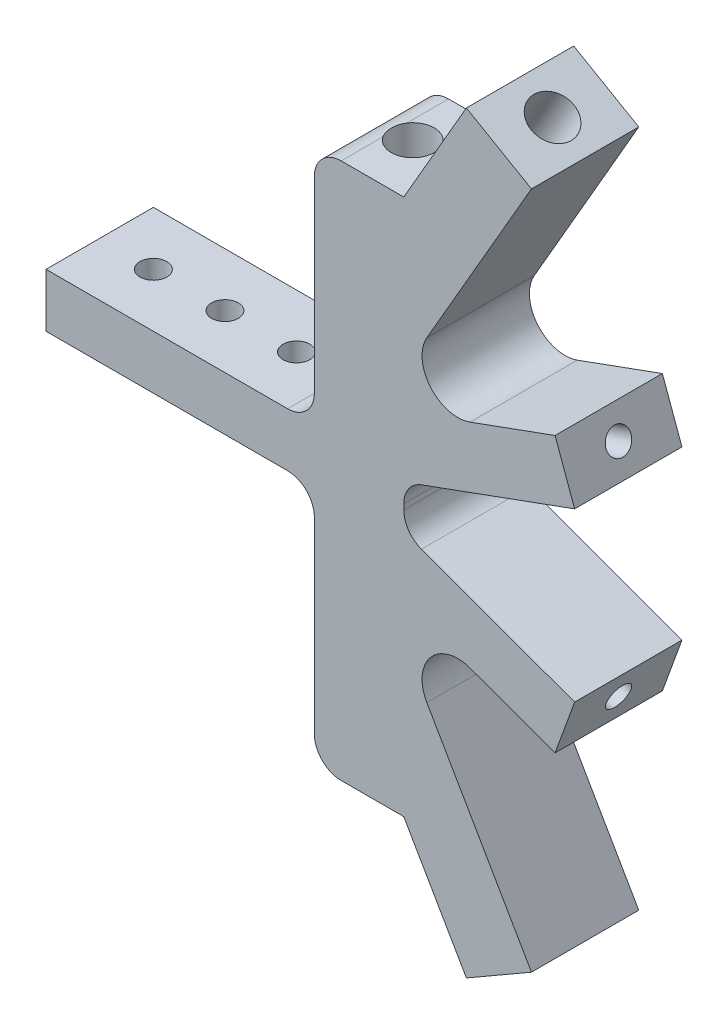
from build123d import *

# Parameters (mm, degrees)
EXTRUDE_1_DEPTH      = 6
FILLET_4_R           = 1.5
FILLET_5_R           = 2
SKETCH_7_R           = 1.2
CUT_EXTRUDE_6_DEPTH  = 10
SKETCH_8_R           = 0.7
CUT_EXTRUDE_7_DEPTH  = 10
SKETCH_9_R           = 0.7
CUT_EXTRUDE_8_DEPTH  = 10
SKETCH_10_R          = 0.7
CUT_EXTRUDE_9_DEPTH  = 10
CUT_EXTRUDE_10_REACH = 42.531
SKETCH_11_R          = 1.2
FILLET_6_R           = 1.5
CUT_EXTRUDE_11_REACH = 31.177
SKETCH_12_R          = 0.75


with BuildPart() as part:
    # 草圖1 → 填料-伸長1 (new body)
    with BuildSketch(Plane.XY):
        Polygon((-2.5, 15), (2.5, 15), (6, 21.062177826), (9.637306696, 18.962177826), (2.5, 6.6), (2.5, 4.605368872), (10.957233587, 7.683550162), (12.051698046, 4.676533775), (2.5, 1.2), (2.5, -1.2), (12.051698046, -4.676533775), (10.957233587, -7.683550162), (2.5, -4.605368872), (2.5, -6.6), (9.637306696, -18.962177826), (6, -21.062177826), (2.5, -15), (-2.5, -15), (-2.5, -1.5), (-17.5, -1.5), (-17.5, 1.5), (-2.5, 1.5), align=None)
    extrude(amount=EXTRUDE_1_DEPTH)

    # 圓角4
    # the kernel refuses this fillet: 1.5 mm, written as the material it adds along each edge
    with BuildSketch(Plane(origin=(-2.5, -1.5, 0), x_dir=(0, -1, 0), z_dir=(0, 0, 1)), Plane(origin=(-2.5, 1.5, 0), x_dir=(-1, 0, 0), z_dir=(0, 0, 1))) as fillet_4_piece_1:
        with BuildLine():
            CenterArc((FILLET_4_R, -FILLET_4_R), FILLET_4_R, 90, 90)
            Line((0, -FILLET_4_R), (-FILLET_4_R * 0.02, -FILLET_4_R))
            Line((-FILLET_4_R * 0.02, -FILLET_4_R), (-FILLET_4_R * 0.02, FILLET_4_R * 0.02))
            Line((-FILLET_4_R * 0.02, FILLET_4_R * 0.02), (FILLET_4_R, FILLET_4_R * 0.02))
            Line((FILLET_4_R, FILLET_4_R * 0.02), (FILLET_4_R, 0))
        make_face()
    extrude(amount=6)
    with BuildSketch(Plane(origin=(2.5, 4.605368872, 0), x_dir=(0, 1, 0), z_dir=(0, 0, 1))) as fillet_4_piece_2:
        with BuildLine():
            CenterArc((2.139664035, -1.492972021), FILLET_4_R, 95.548517206, 104.451482794)
            Line((0.730125104, -2.006002236), (0.701934325, -2.01626284))
            Line((0.701934325, -2.01626284), (-0.028190779, -0.010260604))
            Line((-0.028190779, -0.010260604), (0, 0.03))
            ThreePointArc((0, 0.03), (0.997315564, 0.03), (1.99173047, 0.02985944))
            Line((1.99173047, 0.02985944), (1.994631128, 0))
        make_face()
    extrude(amount=6)
    with BuildSketch(Plane(origin=(2.5, 1.2, 0), x_dir=(0.9396926207859073, 0.34202014332567154, 0), z_dir=(0, 0, 1)), Plane(origin=(2.5, -1.2, 0), x_dir=(0, 1, 0), z_dir=(0, 0, 1))) as fillet_4_piece_3:
        with BuildLine():
            CenterArc((FILLET_4_R * 0.70020753821, -FILLET_4_R), FILLET_4_R, 90, 70)
            Line((-FILLET_4_R * 0.239485082576, -FILLET_4_R * 0.657979856674), (-FILLET_4_R * 0.258278934992, -FILLET_4_R * 0.651139453808))
            Line((-FILLET_4_R * 0.258278934992, -FILLET_4_R * 0.651139453808), (-FILLET_4_R * 0.0140041507642, FILLET_4_R * 0.02))
            Line((-FILLET_4_R * 0.0140041507642, FILLET_4_R * 0.02), (FILLET_4_R * 0.70020753821, FILLET_4_R * 0.02))
            Line((FILLET_4_R * 0.70020753821, FILLET_4_R * 0.02), (FILLET_4_R * 0.70020753821, 0))
        make_face()
    extrude(amount=6)
    with BuildSketch(Plane(origin=(2.5, -4.605368872, 0), x_dir=(0.9396926207859109, -0.34202014332566216, 0), z_dir=(0, 0, 1))) as fillet_4_piece_4:
        with BuildLine():
            CenterArc((2.134742991, -1.5), FILLET_4_R, 90, 104.451482794)
            Line((0.682204024, -1.874340152), (0.653153245, -1.881826955))
            ThreePointArc((0.653153245, -1.881826955), (0.312911234, -0.94743068), (-0.028190779, -0.010260604))
            Line((-0.028190779, -0.010260604), (0, 0.03))
            Line((0, 0.03), (2.134742991, 0.03))
            Line((2.134742991, 0.03), (2.134742991, 0))
        make_face()
    extrude(amount=6)

    # 圓角5
    fillet_5_edges = [part.edges().sort_by_distance(p)[0] for p in [
        (2.5, -6.6, 3),
        (2.5, 6.6, 3),
    ]]
    fillet(fillet_5_edges, radius=FILLET_5_R)

    # 草圖7 → 除料-伸長6 (cut)
    with BuildSketch(Plane(origin=(10.620190528, 18.394709581, 0), x_dir=(0.8660254037844364, -0.5000000000000041, 0), z_dir=(0.5000000000000041, 0.8660254037844364, 0))):
        with Locations(Location((-3.234936491, -3, 0), (0, 0, 180))):
            Circle(SKETCH_7_R)
    extrude(amount=-CUT_EXTRUDE_6_DEPTH, mode=Mode.SUBTRACT)

    # 草圖8 → 除料-伸長7 (cut)
    with BuildSketch(Plane(origin=(10.620190528, -18.394709581, 0), x_dir=(0.8660254037844356, 0.5000000000000054, 0), z_dir=(0.5000000000000054, -0.8660254037844356, 0))):
        with Locations((-3.234936491, 3)):
            Circle(SKETCH_8_R)
    extrude(amount=-CUT_EXTRUDE_7_DEPTH, mode=Mode.SUBTRACT)

    # 草圖9 → 除料-伸長8 (cut)
    with BuildSketch(Plane(origin=(12.144926165, -4.420391622, 0), x_dir=(0, 0, -1), z_dir=(0.9396926207859106, -0.3420201433256625, 0))):
        with Locations(Location((-3, -1.872580787, 0), (0, 0, 90))):
            Circle(SKETCH_9_R)
    extrude(amount=-CUT_EXTRUDE_8_DEPTH, mode=Mode.SUBTRACT)

    # 草圖10 → 除料-伸長9 (cut)
    with BuildSketch(Plane(origin=(12.144926165, 4.420391622, 0), x_dir=(0, 0, -1), z_dir=(0.9396926207859082, 0.3420201433256692, 0))):
        with Locations(Location((-3, 1.872580787, 0), (0, 0, 90))):
            Circle(SKETCH_10_R)
    extrude(amount=-CUT_EXTRUDE_9_DEPTH, mode=Mode.SUBTRACT)

    # 草圖11 → 除料-伸長10 (cut, up to next)
    with BuildSketch(Plane.XZ.offset(15), mode=Mode.PRIVATE) as cut_extrude_10_sk1:
        with Locations(Location((0, 3, 0), (0, 0, 270))):
            Circle(SKETCH_11_R)
    cut_extrude_10_tool1 = extrude(cut_extrude_10_sk1.sketch, amount=-CUT_EXTRUDE_10_REACH, mode=Mode.PRIVATE) & part.part
    add(cut_extrude_10_tool1.solids().sort_by_distance((0, -15, 3))[0], mode=Mode.SUBTRACT)

    # 圓角6
    # the kernel refuses this fillet: 1.5 mm, written as the material it takes off along each edge
    with BuildSketch(Plane(origin=(-2.5, -15, -3.75), x_dir=(1, 0, 0), z_dir=(0, 0, 1)), Plane(origin=(-2.5, 15, -3.75), x_dir=(0, -1, 0), z_dir=(0, 0, 1))) as fillet_6_piece_1:
        with BuildLine():
            CenterArc((FILLET_6_R, FILLET_6_R), FILLET_6_R, 180, 90)
            Line((0, FILLET_6_R), (0, 0))
            Line((0, 0), (FILLET_6_R, 0))
        make_face()
    extrude(amount=13.5, mode=Mode.SUBTRACT)

    # 草圖12 → 除料-伸長11 (cut, up to next)
    with BuildSketch(Plane.XZ.offset(1.5), mode=Mode.PRIVATE) as cut_extrude_11_sk1:
        with Locations((-6.5, 3)):
            Circle(SKETCH_12_R)
    cut_extrude_11_tool1 = extrude(cut_extrude_11_sk1.sketch, amount=-CUT_EXTRUDE_11_REACH, mode=Mode.PRIVATE) & part.part
    # 草圖12 → 除料-伸長11 (cut, up to next)
    with BuildSketch(Plane.XZ.offset(1.5), mode=Mode.PRIVATE) as cut_extrude_11_sk2:
        with Locations((-10.5, 3)):
            Circle(SKETCH_12_R)
    cut_extrude_11_tool2 = extrude(cut_extrude_11_sk2.sketch, amount=-CUT_EXTRUDE_11_REACH, mode=Mode.PRIVATE) & part.part
    # 草圖12 → 除料-伸長11 (cut, up to next)
    with BuildSketch(Plane.XZ.offset(1.5), mode=Mode.PRIVATE) as cut_extrude_11_sk3:
        with Locations((-14.5, 3)):
            Circle(SKETCH_12_R)
    cut_extrude_11_tool3 = extrude(cut_extrude_11_sk3.sketch, amount=-CUT_EXTRUDE_11_REACH, mode=Mode.PRIVATE) & part.part
    add(cut_extrude_11_tool1.solids().sort_by_distance((-6.5, -1.5, 3))[0], mode=Mode.SUBTRACT)
    add(cut_extrude_11_tool2.solids().sort_by_distance((-10.5, -1.5, 3))[0], mode=Mode.SUBTRACT)
    add(cut_extrude_11_tool3.solids().sort_by_distance((-14.5, -1.5, 3))[0], mode=Mode.SUBTRACT)


solid = part.part
